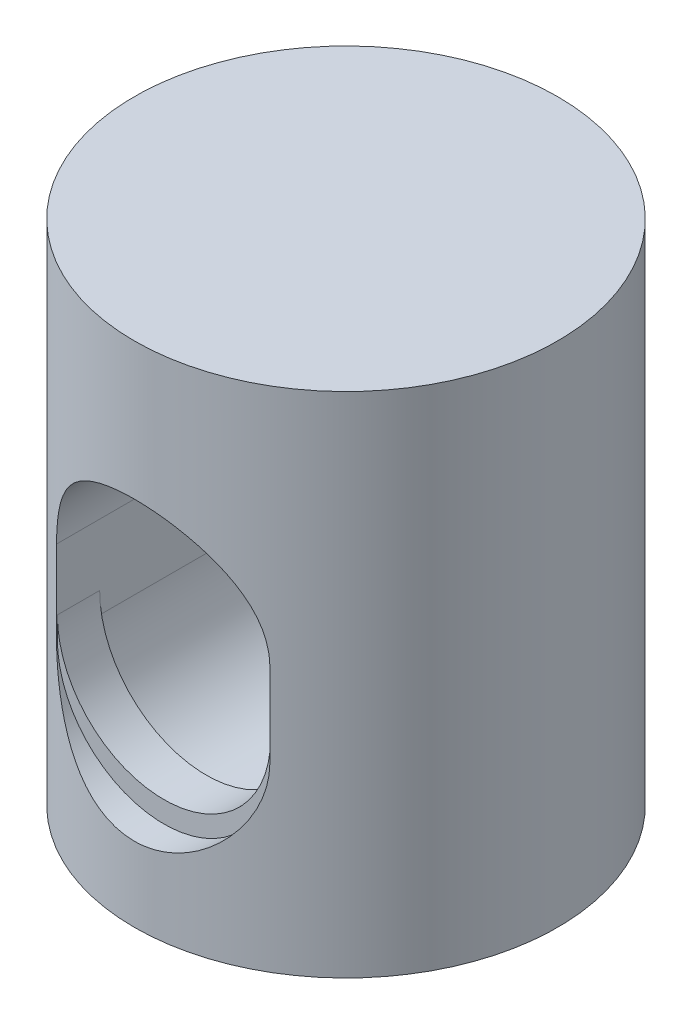
from build123d import *

# Parameters (mm, degrees)
SKETCH2_R           = 6.35
BOSS_EXTRUDE1_DEPTH = 15.24
CUT_EXTRUDE1_DEPTH  = 0.889
CUT_EXTRUDE2_REACH  = 22.83
CUT_EXTRUDE3_REACH  = 22.83
CUT_EXTRUDE4_REACH  = 24.989
CUT_EXTRUDE4_START  = -2.159


with BuildPart() as part:
    # Sketch2 → Boss-Extrude1 (new body)
    with BuildSketch(Plane(origin=(0, 0, 0), x_dir=(1, 0, 0), z_dir=(0, 1, 0))):
        Circle(SKETCH2_R)
    extrude(amount=BOSS_EXTRUDE1_DEPTH)

    # Sketch4 → Cut-Extrude1 (cut)
    with BuildSketch(Plane.XY.offset(6.35)):
        with BuildLine():
            Line((-3.2004, 5.440753423), (-3.2004, 7.929953423))
            ThreePointArc((-3.2004, 7.929953423), (0, 11.130353423), (3.2004, 7.929953423))
            Line((3.2004, 7.929953423), (3.2004, 5.440753423))
            ThreePointArc((3.2004, 5.440753423), (0, 2.240353423), (-3.2004, 5.440753423))
        make_face()
    extrude(amount=-CUT_EXTRUDE1_DEPTH, mode=Mode.SUBTRACT)

    # Sketch4<3> → Cut-Extrude2 (cut, up to next)
    with BuildSketch(Plane.XY.offset(6.35), mode=Mode.PRIVATE) as cut_extrude2_sk1:
        with BuildLine():
            ThreePointArc((3.2004, 6.075753423), (0, 9.276153423), (-3.2004, 6.075753423))
            ThreePointArc((-3.2004, 6.075753423), (0, 2.875353423), (3.2004, 6.075753423))
        make_face()
    cut_extrude2_tool1 = extrude(cut_extrude2_sk1.sketch, amount=-CUT_EXTRUDE2_REACH, mode=Mode.PRIVATE) & part.part
    add(cut_extrude2_tool1.solids().sort_by_distance((0, 6.075753, 6.35))[0], mode=Mode.SUBTRACT)

    # Sketch4<4> → Cut-Extrude3 (cut, up to next)
    with BuildSketch(Plane.XY.offset(6.35), mode=Mode.PRIVATE) as cut_extrude3_sk1:
        with BuildLine():
            Line((-3.2004, 7.929953423), (-3.2004, 6.075753423))
            ThreePointArc((-3.2004, 6.075753423), (0, 9.276153423), (3.2004, 6.075753423))
            Line((3.2004, 6.075753423), (3.2004, 7.929953423))
            ThreePointArc((3.2004, 7.929953423), (0, 11.130353423), (-3.2004, 7.929953423))
        make_face()
    cut_extrude3_tool1 = extrude(cut_extrude3_sk1.sketch, amount=-CUT_EXTRUDE3_REACH, mode=Mode.PRIVATE) & part.part
    add(cut_extrude3_tool1.solids().sort_by_distance((0, 9.516442, 6.35))[0], mode=Mode.SUBTRACT)

    # Sketch4<5> → Cut-Extrude4 (cut, up to next)
    with BuildSketch(Plane.XY.offset(6.35).offset(CUT_EXTRUDE4_START), mode=Mode.PRIVATE) as cut_extrude4_sk1:
        with BuildLine():
            Line((-3.2004, 5.440753423), (-3.2004, 7.929953423))
            ThreePointArc((-3.2004, 7.929953423), (0, 11.130353423), (3.2004, 7.929953423))
            Line((3.2004, 7.929953423), (3.2004, 5.440753423))
            ThreePointArc((3.2004, 5.440753423), (0, 2.240353423), (-3.2004, 5.440753423))
        make_face()
    cut_extrude4_tool1 = extrude(cut_extrude4_sk1.sketch, amount=-CUT_EXTRUDE4_REACH, mode=Mode.PRIVATE) & part.part
    add(cut_extrude4_tool1.solids().sort_by_distance((0, 6.685353, 4.191))[0], mode=Mode.SUBTRACT)


solid = part.part
